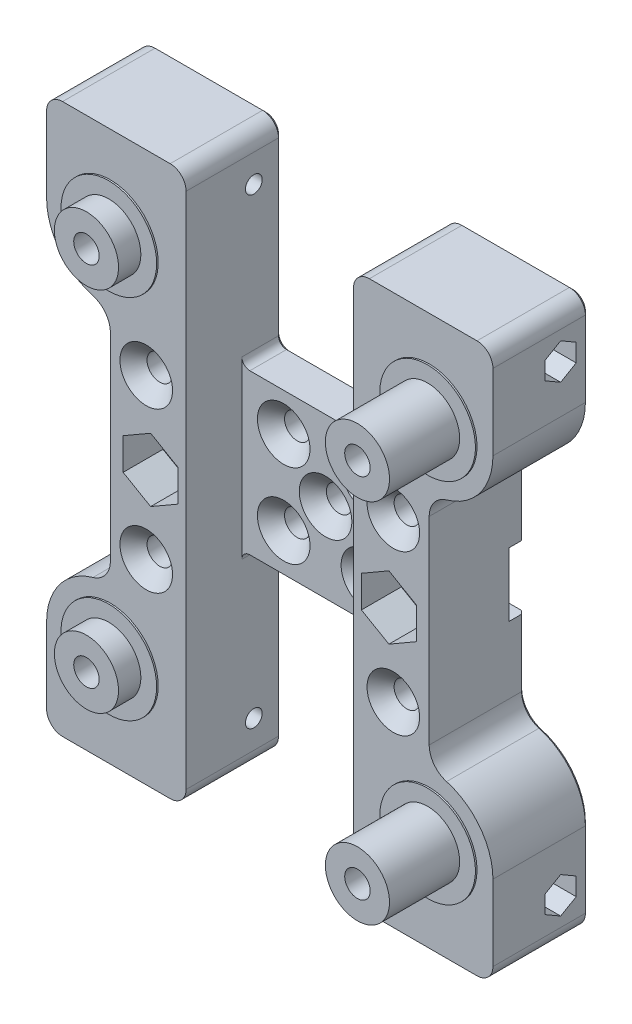
from build123d import *

# Parameters (mm, degrees)
EXTRUDE_1_DEPTH              = 10
EXTRUDE_1_DEPTH_BACK         = 2
SKETCH_2_W                   = 40
SKETCH_2_H                   = 20
EXTRUDE_2_DEPTH              = 12
FILLET_1_R                   = 3
SKETCH_5_R                   = 2.9
CUT_EXTRUDE_1_DEPTH          = 5
SKETCH_7_R                   = 4.025
EXTRUDE_3_DEPTH              = 9
SKETCH_8_R                   = 1.6
CUT_EXTRUDE_2_DEPTH          = 47.75467891
SKETCH_12_R                  = 6
SKETCH_12_R_2                = 4.025
EXTRUDE_4_DEPTH              = 0.2
FILLET_1_OF_MIRROR_1_R       = 3
MIRROR_START                 = -2
MIRROR_2_OUTLINE_R           = 2.9
MIRROR_2_DEPTH               = 12
MIRROR_START_2               = 3
MIRROR_2_2_OUTLINE_R         = 4.025
MIRROR_2_2_OUTLINE_R_2       = 1.6
MIRROR_2_2_DEPTH             = 16
MIRROR_START_3               = 10
MIRROR_2_3_OUTLINE_R         = 6
MIRROR_2_3_OUTLINE_R_2       = 4.025
MIRROR_2_3_DEPTH             = 0.2
SKETCH_10_W                  = 18.534734398
SKETCH_10_H                  = 62.531326151
CUT_EXTRUDE_3_DEPTH          = 6
EXTRUDE_5_DEPTH              = 12
SKETCH_13_R                  = 1.6
CUT_EXTRUDE_5_DEPTH          = 50.145193051
FILLET_3_R                   = 2
FILLET_3_OF_MIRROR_3_R       = 2
MIRROR_4_OUTLINE_R           = 1.6
MIRROR_4_DEPTH               = 12
MIRROR_4_2_DEPTH             = 12
SKETCH_11_R                  = 1.05
CUT_EXTRUDE_4_DEPTH          = 63.090659523
SKETCH_14_R                  = 2.05
CUT_EXTRUDE_6_DEPTH          = 50.145193051
SKETCH_15_R                  = 1.6
CUT_EXTRUDE_7_DEPTH          = 50.145193051
CUT_EXTRUDE_8_DEPTH          = 50.145193051
CUT_EXTRUDE_8_DEPTH_BACK     = 50.145193051
SKETCH_16_R                  = 1.6
PATTERN_CIRCULAR_1_COUNT     = 4
CUT_EXTRUDE_START            = -5
CUT_EXTRUDE_9_DEPTH          = 52.024450024
SKETCH_18_W                  = 21
SKETCH_18_H                  = 25.296352044
CUT_EXTRUDE_10_DEPTH         = 7
CUT_EXTRUDE_11_DEPTH         = 5
FILLET_4_R                   = 1
EXTRUDE_START                = 0.2
EXTRUDE_6_DEPTH              = 0.2
EXTRUDE_START_2              = 0.4
EXTRUDE_7_DEPTH              = 0.4
MIRROR_START_4               = 0.2
MIRROR_9_COPY_1_DEPTH        = 0.2
MIRROR_START_5               = 0.4
MIRROR_9_COPY_2_DEPTH        = 0.4
CHAMFER_1_SIZE               = 0.4
CUT_EXTRUDE_13_DEPTH         = 4
HOLE_WIZARD_M3_1_D           = 3.2
HOLE_WIZARD_M3_1_CSINK_D     = 6.6
HOLE_WIZARD_M3_1_CSINK_ANGLE = 90
HOLE_WIZARD_M3_2_D           = 3.2
HOLE_WIZARD_M3_2_CSINK_D     = 6.6
HOLE_WIZARD_M3_2_CSINK_ANGLE = 90


# Read off the part's stored shape, not the designer's step: 镜向2, 镜向4
with BuildPart() as part:
    # 草图2 → 凸台-拉伸1 (new, two sides: drawn at the far end of the back side and taken through both)
    with BuildSketch(Plane.XY.offset(-EXTRUDE_1_DEPTH_BACK)):
        Rectangle(SKETCH_2_W, SKETCH_2_H)
    extrude(amount=EXTRUDE_1_DEPTH + EXTRUDE_1_DEPTH_BACK)

    # 草图3 → 凸台-拉伸2 (add)
    with BuildSketch(Plane(origin=(0, 0, -2), x_dir=(-1, 0, 0), z_dir=(0, 0, -1))):
        with BuildLine():
            Line((20, 10), (10.5, 10))
            Line((10.5, 10), (10.5, 25))
            Line((10.5, 25), (14.482758621, 28.793103448))
            ThreePointArc((14.482758621, 28.793103448), (27.427813527, 25.971125411), (20, 15))
            Line((20, 15), (20, 10))
        make_face()
    extrude_2 = extrude(amount=-EXTRUDE_2_DEPTH)

    # 圆角1
    fillet_1_edges = [part.edges().sort_by_distance(p)[0] for p in [
        (-20, 15, 4),
    ]]
    fillet(fillet_1_edges, radius=FILLET_1_R)

    # 草图5 → 切除-拉伸1 (cut)
    with BuildSketch(Plane(origin=(0, 0, -2), x_dir=(-1, 0, 0), z_dir=(0, 0, -1))):
        with Locations((20, 23)):
            Circle(SKETCH_5_R)
    cut_extrude_1 = extrude(amount=-CUT_EXTRUDE_1_DEPTH, mode=Mode.SUBTRACT)

    # 草图7 → 凸台-拉伸3 (add)
    with BuildSketch(Plane.XY.offset(10)):
        with Locations(Location((-20, 23, 0), (0, 0, 180))):
            Circle(SKETCH_7_R)
    extrude_3 = extrude(amount=EXTRUDE_3_DEPTH)

    # 草图8 → 切除-拉伸2 (cut, through all)
    with BuildSketch(Plane.XY.offset(19)):
        with Locations((-20, 23)):
            Circle(SKETCH_8_R)
    cut_extrude_2 = extrude(amount=-CUT_EXTRUDE_2_DEPTH, mode=Mode.SUBTRACT)

    # 草图12 → 凸台-拉伸4 (add)
    with BuildSketch(Plane.XY.offset(10)):
        with Locations(Location((-20, 23, 0), (0, 0, 180))):
            Circle(SKETCH_12_R)
        with Locations((-20, 23)):
            Circle(SKETCH_12_R_2, mode=Mode.SUBTRACT)
    extrude_4 = extrude(amount=EXTRUDE_4_DEPTH)

    # 镜向1: 凸台-拉伸2, 切除-拉伸1, 凸台-拉伸3, 切除-拉伸2, 凸台-拉伸4 across plane
    add(extrude_2.mirror(Plane.ZX))
    add(cut_extrude_1.mirror(Plane.ZX), mode=Mode.SUBTRACT)
    add(extrude_3.mirror(Plane.ZX))
    add(cut_extrude_2.mirror(Plane.ZX), mode=Mode.SUBTRACT)
    add(extrude_4.mirror(Plane.ZX))

    # 圆角1 of 镜向1
    fillet_1_of_mirror_1_edges = [part.edges().sort_by_distance(p)[0] for p in [
        (-20, -15, 4),
    ]]
    fillet(fillet_1_of_mirror_1_edges, radius=FILLET_1_OF_MIRROR_1_R)

    # 镜向2 outline → 镜向2 (add)
    # profile 1 of 2: a face of its own
    with BuildSketch(Plane.XY.offset(MIRROR_START)):
        with BuildLine():
            ThreePointArc((22.181818182, -15.303268913), (20.606827894, -14.226062823), (20, -12.416994756))
            Line((20, -12.416994756), (20, -10))
            Line((20, -10), (10.5, -10))
            Line((10.5, -10), (10.5, -25))
            Line((10.5, -25), (14.482758621, -28.793103448))
            ThreePointArc((14.482758621, -28.793103448), (26.948033601, -26.96545446), (22.181818182, -15.303268913))
        make_face()
        with Locations((20, -23)):
            Circle(MIRROR_2_OUTLINE_R, mode=Mode.SUBTRACT)
    # profile 2 of 2: a face of its own
    with BuildSketch(Plane.XY.offset(MIRROR_START)):
        with BuildLine():
            Line((10.5, 10), (20, 10))
            Line((20, 10), (20, 12.416994756))
            ThreePointArc((20, 12.416994756), (20.606827894, 14.226062823), (22.181818182, 15.303268913))
            ThreePointArc((22.181818182, 15.303268913), (26.948033601, 26.96545446), (14.482758621, 28.793103448))
            Line((14.482758621, 28.793103448), (10.5, 25))
            Line((10.5, 25), (10.5, 10))
        make_face()
        with Locations((20, 23)):
            Circle(MIRROR_2_OUTLINE_R, mode=Mode.SUBTRACT)
    extrude(amount=MIRROR_2_DEPTH)

    # Mirror 2 2 outline → Mirror 2 2 (add)
    # profile 1 of 2: a face of its own
    with BuildSketch(Plane.XY.offset(MIRROR_START_2)):
        with Locations((20, 23)):
            Circle(MIRROR_2_2_OUTLINE_R)
        with Locations((20, 23)):
            Circle(MIRROR_2_2_OUTLINE_R_2, mode=Mode.SUBTRACT)
    # profile 2 of 2: a face of its own
    with BuildSketch(Plane.XY.offset(MIRROR_START_2)):
        with Locations((20, -23)):
            Circle(MIRROR_2_2_OUTLINE_R)
        with Locations((20, -23)):
            Circle(MIRROR_2_2_OUTLINE_R_2, mode=Mode.SUBTRACT)
    extrude(amount=MIRROR_2_2_DEPTH)

    # Mirror 2 3 outline → Mirror 2 3 (add)
    # profile 1 of 2: a face of its own
    with BuildSketch(Plane.XY.offset(MIRROR_START_3)):
        with Locations((20, -23)):
            Circle(MIRROR_2_3_OUTLINE_R)
        with Locations((20, -23)):
            Circle(MIRROR_2_3_OUTLINE_R_2, mode=Mode.SUBTRACT)
    # profile 2 of 2: a face of its own
    with BuildSketch(Plane.XY.offset(MIRROR_START_3)):
        with Locations((20, 23)):
            Circle(MIRROR_2_3_OUTLINE_R)
        with Locations((20, 23)):
            Circle(MIRROR_2_3_OUTLINE_R_2, mode=Mode.SUBTRACT)
    extrude(amount=MIRROR_2_3_DEPTH)

    # 草图10 → 切除-拉伸3 (cut)
    with BuildSketch(Plane.XY.offset(19)):
        with Locations((-22.793978919, -0.149764262)):
            Rectangle(SKETCH_10_W, SKETCH_10_H)
    extrude(amount=-CUT_EXTRUDE_3_DEPTH, mode=Mode.SUBTRACT)

    # 草图24 → 凸台-拉伸5 (add)
    with BuildSketch(Plane(origin=(0, 0, -2), x_dir=(-1, 0, 0), z_dir=(0, 0, -1))):
        with BuildLine():
            Line((-28, -34.5), (-10.5, -34.5))
            Line((-10.5, -34.5), (-10.5, -25))
            Line((-10.5, -25), (-14.482758621, -28.793103448))
            ThreePointArc((-14.482758621, -28.793103448), (-23.151354389, -30.35316024), (-28, -23))
            Line((-28, -23), (-28, -34.5))
        make_face()
    extrude_5 = extrude(amount=-EXTRUDE_5_DEPTH)

    # 草图13 → 切除-拉伸5 (cut, symmetric)
    with BuildSketch(Plane(origin=(0, 0, -2), x_dir=(-1, 0, 0), z_dir=(0, 0, -1))):
        with Locations((-15.5, -10)):
            Circle(SKETCH_13_R)
    cut_extrude_5 = extrude(amount=CUT_EXTRUDE_5_DEPTH, both=True, mode=Mode.SUBTRACT)

    # 圆角3
    fillet_3_edges = [part.edges().sort_by_distance(p)[0] for p in [
        (28, -34.5, 4),
        (10.5, -34.5, 4),
    ]]
    fillet(fillet_3_edges, radius=FILLET_3_R)

    # 镜向3: 凸台-拉伸5, 切除-拉伸5 across plane
    add(extrude_5.mirror(Plane.ZX))
    add(cut_extrude_5.mirror(Plane.ZX), mode=Mode.SUBTRACT)

    # 圆角3 of 镜向3
    fillet_3_of_mirror_3_edges = [part.edges().sort_by_distance(p)[0] for p in [
        (28, 34.5, 4),
        (10.5, 34.5, 4),
    ]]
    fillet(fillet_3_of_mirror_3_edges, radius=FILLET_3_OF_MIRROR_3_R)

    # 镜向4 outline → 镜向4 (cut)
    with BuildSketch(Plane.XY.offset(MIRROR_START)):
        with Locations((-15.5, -10)):
            Circle(MIRROR_4_OUTLINE_R)
        with Locations((-15.5, 10)):
            Circle(MIRROR_4_OUTLINE_R)
    extrude(amount=MIRROR_4_DEPTH, mode=Mode.SUBTRACT)

    # Mirror 4 2 outline → Mirror 4 2 (add)
    with BuildSketch(Plane.XY.offset(MIRROR_START)):
        with BuildLine():
            Line((-14.482758621, 28.793103448), (-10.5, 25))
            Line((-10.5, 25), (-10.5, 32.5))
            ThreePointArc((-10.5, 32.5), (-11.085786438, 33.914213562), (-12.5, 34.5))
            Line((-12.5, 34.5), (-26, 34.5))
            ThreePointArc((-26, 34.5), (-27.414213562, 33.914213562), (-28, 32.5))
            Line((-28, 32.5), (-28, 23))
            ThreePointArc((-28, 23), (-23.151354389, 30.35316024), (-14.482758621, 28.793103448))
        make_face()
        with BuildLine():
            Line((-10.5, -32.5), (-10.5, -25))
            Line((-10.5, -25), (-14.482758621, -28.793103448))
            ThreePointArc((-14.482758621, -28.793103448), (-23.151354389, -30.35316024), (-28, -23))
            Line((-28, -23), (-28, -32.5))
            ThreePointArc((-28, -32.5), (-27.414213562, -33.914213562), (-26, -34.5))
            Line((-26, -34.5), (-12.5, -34.5))
            ThreePointArc((-12.5, -34.5), (-11.085786438, -33.914213562), (-10.5, -32.5))
        make_face()
    extrude(amount=MIRROR_4_2_DEPTH)

    # 草图11 → 切除-拉伸4 (cut, symmetric)
    with BuildSketch(Plane(origin=(20, 0, 0), x_dir=(0, 0, -1), z_dir=(1, 0, 0))):
        with Locations((-1.5, -29)):
            Circle(SKETCH_11_R)
    cut_extrude_4 = extrude(amount=CUT_EXTRUDE_4_DEPTH, both=True, mode=Mode.SUBTRACT)

    # 草图14 → 切除-拉伸6 (cut, symmetric)
    with BuildSketch(Plane(origin=(0, 0, -2), x_dir=(-1, 0, 0), z_dir=(0, 0, -1))):
        with Locations((14.95, 0)):
            Circle(SKETCH_14_R)
    cut_extrude_6 = extrude(amount=CUT_EXTRUDE_6_DEPTH, both=True, mode=Mode.SUBTRACT)

    # 草图15 → 切除-拉伸7 (cut, symmetric)
    with BuildSketch(Plane(origin=(0, 0, -2), x_dir=(-1, 0, 0), z_dir=(0, 0, -1))):
        with Locations((5.25, 5.25)):
            Circle(SKETCH_15_R)
    cut_extrude_7 = extrude(amount=CUT_EXTRUDE_7_DEPTH, both=True, mode=Mode.SUBTRACT)

    # 草图16 → 切除-拉伸8 (cut, two sides: drawn at the far end of the back side and taken through both)
    with BuildSketch(Plane(origin=(0, 0, -2), x_dir=(-1, 0, 0), z_dir=(0, 0, -1)).offset(-CUT_EXTRUDE_8_DEPTH_BACK)):
        Circle(SKETCH_16_R)
    extrude(amount=CUT_EXTRUDE_8_DEPTH + CUT_EXTRUDE_8_DEPTH_BACK, mode=Mode.SUBTRACT)

    # 阵列(圆周)1: 切除-拉伸7 ×4 about axis
    pattern_circular_1_axis = Axis((0, 0, 0), (0, 0, 1))
    for i in range(1, PATTERN_CIRCULAR_1_COUNT):
        add(cut_extrude_7.rotate(pattern_circular_1_axis, i * 360 / PATTERN_CIRCULAR_1_COUNT), mode=Mode.SUBTRACT)

    # 镜向5: 切除-拉伸6 across plane
    add(cut_extrude_6.mirror(Plane(origin=(0, 0, 0), x_dir=(0, 0, 1), z_dir=(1, 0, 0))), mode=Mode.SUBTRACT)

    # 草图17 → 切除-拉伸9 (cut)
    with BuildSketch(Plane.XY.offset(10).offset(CUT_EXTRUDE_START)):
        Polygon((-11.5, 1.991858429), (-14.95, 3.983716857), (-18.4, 1.991858429), (-18.4, -1.991858429), (-14.95, -3.983716857), (-11.5, -1.991858429), align=None)
    cut_extrude_9 = extrude(amount=CUT_EXTRUDE_9_DEPTH, mode=Mode.SUBTRACT)

    # 镜向6: 切除-拉伸9 across plane
    add(cut_extrude_9.mirror(Plane(origin=(0, 0, 0), x_dir=(0, 0, 1), z_dir=(1, 0, 0))), mode=Mode.SUBTRACT)

    # 草图18 → 切除-拉伸10 (cut)
    with BuildSketch(Plane.XY.offset(10)):
        Rectangle(SKETCH_18_W, SKETCH_18_H)
    extrude(amount=-CUT_EXTRUDE_10_DEPTH, mode=Mode.SUBTRACT)

    # 草图19 → 切除-拉伸11 (cut)
    with BuildSketch(Plane(origin=(28, 0, 0), x_dir=(0, 0, -1), z_dir=(1, 0, 0))):
        Polygon((0.45, -27.874166975), (-1.5, -26.74833395), (-3.45, -27.874166975), (-3.45, -30.125833025), (-1.5, -31.25166605), (0.45, -30.125833025), align=None)
    cut_extrude_11 = extrude(amount=-CUT_EXTRUDE_11_DEPTH, mode=Mode.SUBTRACT)

    # 草图23 → M2 六角头螺栓的柱形沉头孔2 (revolve, cut)
    with BuildSketch(Plane(origin=(-28, -29, 1.5), x_dir=(0, 0, 1), z_dir=(0, 1, 0))):
        Polygon((0, 0), (0, 10.781118805), (1.3, 10), (1.3, 5), (2.25, 5), (2.25, 0), align=None)
    hole_wizard_m2_2 = revolve(axis=Axis((-34.35, -29, 1.5), (1, 0, 0)), mode=Mode.SUBTRACT)

    # 镜向7: 切除-拉伸4, 切除-拉伸11, M2 六角头螺栓的柱形沉头孔2 across plane
    add(cut_extrude_4.mirror(Plane.ZX), mode=Mode.SUBTRACT)
    add(cut_extrude_11.mirror(Plane.ZX), mode=Mode.SUBTRACT)
    add(hole_wizard_m2_2.mirror(Plane.ZX), mode=Mode.SUBTRACT)

    # 圆角4
    fillet_4_edges = [part.edges().sort_by_distance(p)[0] for p in [
        (10.5, -10, 0.5),
        (10.5, 10, 0.5),
        (-10.5, -10, 0.5),
        (-10.5, 10, 0.5),
    ]]
    fillet(fillet_4_edges, radius=FILLET_4_R)

    # 草图25 → 凸台-拉伸6 (add)
    with BuildSketch(Plane(origin=(0, 0, 3), x_dir=(-1, 0, 0), z_dir=(0, 0, -1)).offset(EXTRUDE_START)):
        with BuildLine():
            ThreePointArc((-21.6, 25.418677324), (-22.9, 23), (-21.6, 20.581322676))
            Line((-21.6, 20.581322676), (-21.6, 25.418677324))
        make_face()
        with BuildLine():
            Line((-18.4, 25.418677324), (-18.4, 20.581322676))
            ThreePointArc((-18.4, 20.581322676), (-17.1, 23), (-18.4, 25.418677324))
        make_face()
    extrude_6 = extrude(amount=-EXTRUDE_6_DEPTH)

    # 草图25<3> → 凸台-拉伸7 (add)
    with BuildSketch(Plane(origin=(0, 0, 3), x_dir=(-1, 0, 0), z_dir=(0, 0, -1)).offset(EXTRUDE_START_2)):
        with BuildLine():
            ThreePointArc((-18.4, 25.418677324), (-20, 25.9), (-21.6, 25.418677324))
            Line((-21.6, 25.418677324), (-21.6, 24.6))
            Line((-21.6, 24.6), (-18.4, 24.6))
            Line((-18.4, 24.6), (-18.4, 25.418677324))
        make_face()
        with BuildLine():
            Line((-21.6, 24.6), (-21.6, 25.418677324))
            ThreePointArc((-21.6, 25.418677324), (-22.050609665, 25.050609665), (-22.418677324, 24.6))
            Line((-22.418677324, 24.6), (-21.6, 24.6))
        make_face()
        with BuildLine():
            ThreePointArc((-17.581322676, 24.6), (-17.949390335, 25.050609665), (-18.4, 25.418677324))
            Line((-18.4, 25.418677324), (-18.4, 24.6))
            Line((-18.4, 24.6), (-17.581322676, 24.6))
        make_face()
        with BuildLine():
            Line((-17.581322676, 21.4), (-18.4, 21.4))
            Line((-18.4, 21.4), (-18.4, 20.581322676))
            ThreePointArc((-18.4, 20.581322676), (-17.949390335, 20.949390335), (-17.581322676, 21.4))
        make_face()
        with BuildLine():
            Line((-18.4, 21.4), (-21.6, 21.4))
            Line((-21.6, 21.4), (-21.6, 20.581322676))
            ThreePointArc((-21.6, 20.581322676), (-20, 20.1), (-18.4, 20.581322676))
            Line((-18.4, 20.581322676), (-18.4, 21.4))
        make_face()
        with BuildLine():
            Line((-21.6, 20.581322676), (-21.6, 21.4))
            Line((-21.6, 21.4), (-22.418677324, 21.4))
            ThreePointArc((-22.418677324, 21.4), (-22.050609665, 20.949390335), (-21.6, 20.581322676))
        make_face()
    extrude_7 = extrude(amount=-EXTRUDE_7_DEPTH)

    # 镜向8: 凸台-拉伸6, 凸台-拉伸7 across plane
    add(extrude_6.mirror(Plane(origin=(0, 0, 0), x_dir=(0, 0, 1), z_dir=(1, 0, 0))))
    add(extrude_7.mirror(Plane(origin=(0, 0, 0), x_dir=(0, 0, 1), z_dir=(1, 0, 0))))

    # 镜向9: 凸台-拉伸6, 凸台-拉伸7 across plane
    add(extrude_6.mirror(Plane.ZX))
    add(extrude_7.mirror(Plane.ZX))

    # 镜向9 copy 1 sketch → 镜向9 copy 1 (add)
    with BuildSketch(Plane(origin=(0, 0, 3), x_dir=(1, 0, 0), z_dir=(0, 0, -1)).offset(MIRROR_START_4)):
        with BuildLine():
            ThreePointArc((-21.6, 25.418677324), (-22.9, 23), (-21.6, 20.581322676))
            Line((-21.6, 20.581322676), (-21.6, 25.418677324))
        make_face()
        with BuildLine():
            Line((-18.4, 25.418677324), (-18.4, 20.581322676))
            ThreePointArc((-18.4, 20.581322676), (-17.1, 23), (-18.4, 25.418677324))
        make_face()
    extrude(amount=-MIRROR_9_COPY_1_DEPTH)

    # 镜向9 copy 2 sketch → 镜向9 copy 2 (add)
    with BuildSketch(Plane(origin=(0, 0, 3), x_dir=(1, 0, 0), z_dir=(0, 0, -1)).offset(MIRROR_START_5)):
        with BuildLine():
            ThreePointArc((-18.4, 25.418677324), (-20, 25.9), (-21.6, 25.418677324))
            Line((-21.6, 25.418677324), (-21.6, 24.6))
            Line((-21.6, 24.6), (-18.4, 24.6))
            Line((-18.4, 24.6), (-18.4, 25.418677324))
        make_face()
        with BuildLine():
            Line((-21.6, 24.6), (-21.6, 25.418677324))
            ThreePointArc((-21.6, 25.418677324), (-22.050609665, 25.050609665), (-22.418677324, 24.6))
            Line((-22.418677324, 24.6), (-21.6, 24.6))
        make_face()
        with BuildLine():
            ThreePointArc((-17.581322676, 24.6), (-17.949390335, 25.050609665), (-18.4, 25.418677324))
            Line((-18.4, 25.418677324), (-18.4, 24.6))
            Line((-18.4, 24.6), (-17.581322676, 24.6))
        make_face()
        with BuildLine():
            Line((-17.581322676, 21.4), (-18.4, 21.4))
            Line((-18.4, 21.4), (-18.4, 20.581322676))
            ThreePointArc((-18.4, 20.581322676), (-17.949390335, 20.949390335), (-17.581322676, 21.4))
        make_face()
        with BuildLine():
            Line((-18.4, 21.4), (-21.6, 21.4))
            Line((-21.6, 21.4), (-21.6, 20.581322676))
            ThreePointArc((-21.6, 20.581322676), (-20, 20.1), (-18.4, 20.581322676))
            Line((-18.4, 20.581322676), (-18.4, 21.4))
        make_face()
        with BuildLine():
            Line((-21.6, 20.581322676), (-21.6, 21.4))
            Line((-21.6, 21.4), (-22.418677324, 21.4))
            ThreePointArc((-22.418677324, 21.4), (-22.050609665, 20.949390335), (-21.6, 20.581322676))
        make_face()
    extrude(amount=-MIRROR_9_COPY_2_DEPTH)

    # 倒角1
    chamfer_1_edges = [part.edges().sort_by_distance(p)[0] for p in [
        (26.381792282, 18.175818487, -2),
        (20.606827894, 14.226062823, -2),
        (17.1, 23, -2),
        (20, 0, -2),
        (26.381792282, -18.175818487, -2),
        (20.606827894, -14.226062823, -2),
        (17.1, -23, -2),
        (28, -27.75, -2),
        (17.1, -10, -2),
        (19.25, -34.5, -2),
        (10.5, -21.75, -2),
        (27.414213562, -33.914213562, -2),
        (11.085786438, -33.914213562, -2),
        (28, 27.75, -2),
        (17.1, 10, -2),
        (10.5, 21.75, -2),
        (19.25, 34.5, -2),
        (27.414213562, 33.914213562, -2),
        (11.085786438, 33.914213562, -2),
        (-17.1, -10, -2),
        (-28, 27.75, -2),
        (-17.1, 10, -2),
        (-19.25, 34.5, -2),
        (-10.5, 21.75, -2),
        (-27.414213562, 33.914213562, -2),
        (-11.085786438, 33.914213562, -2),
        (-28, -27.75, -2),
        (-10.5, -21.75, -2),
        (-19.25, -34.5, -2),
        (-27.414213562, -33.914213562, -2),
        (-11.085786438, -33.914213562, -2),
        (-20, 0, -2),
        (-26.381792282, 18.175818487, -2),
        (-12.9, 0, -2),
        (-20.606827894, 14.226062823, -2),
        (-3.65, 5.25, -2),
        (1.6, 0, -2),
        (-5.25, -3.65, -2),
        (3.65, -5.25, -2),
        (5.25, 3.65, -2),
        (12.9, 0, -2),
        (-17.1, 23, -2),
        (0, -10, -2),
        (0, 10, -2),
        (10.207106781, -10.292893219, -2),
        (-10.207106781, -10.292893219, -2),
        (-10.207106781, 10.292893219, -2),
        (10.207106781, 10.292893219, -2),
        (-26.381792282, -18.175818487, -2),
        (-20.606827894, -14.226062823, -2),
        (-17.1, -23, -2),
    ]]
    chamfer(chamfer_1_edges, length=CHAMFER_1_SIZE)

    # 草图26 → 切除-拉伸13 (cut, symmetric)
    with BuildSketch(Plane(origin=(0, 0, 0), x_dir=(1, 0, 0), z_dir=(0, 1, 0))):
        Polygon((-18, 2), (-20, 0), (-20, 2), align=None)
    cut_extrude_13 = extrude(amount=CUT_EXTRUDE_13_DEPTH, both=True, mode=Mode.SUBTRACT)

    # 镜向10: 切除-拉伸13 across plane
    add(cut_extrude_13.mirror(Plane(origin=(0, 0, 0), x_dir=(0, 0, 1), z_dir=(1, 0, 0))), mode=Mode.SUBTRACT)

    # M3 十字槽半沉头木螺钉的锥形沉头孔1 (through all)
    with Locations(Plane.XY.offset(3)):
        with Locations((-5.25, 5.25), (5.25, 5.25), (5.25, -5.394016013), (-5.25, -5.25), (0, 0)):
            CounterSinkHole(HOLE_WIZARD_M3_1_D / 2, HOLE_WIZARD_M3_1_CSINK_D / 2, counter_sink_angle=HOLE_WIZARD_M3_1_CSINK_ANGLE)

    # M3 十字槽半沉头木螺钉的锥形沉头孔2 (through all)
    with Locations(Plane.XY.offset(10)):
        with Locations((-15.5, 10), (-15.5, -10), (15.5, 10), (15.5, -10)):
            CounterSinkHole(HOLE_WIZARD_M3_2_D / 2, HOLE_WIZARD_M3_2_CSINK_D / 2, counter_sink_angle=HOLE_WIZARD_M3_2_CSINK_ANGLE)


solid = part.part
